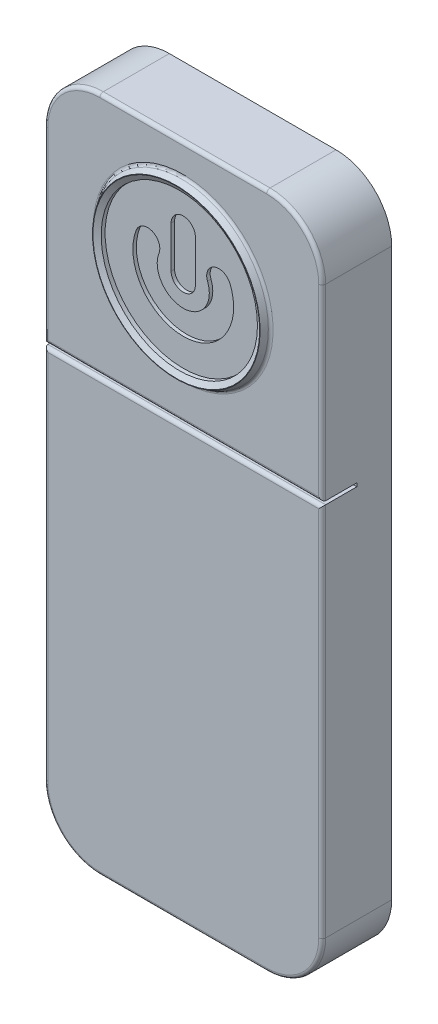
from build123d import *
from OCP.BRepFilletAPI import BRepFilletAPI_MakeChamfer

# Parameters (mm, degrees)
SKETCH1_W           = 8
SKETCH1_H           = 19.5
BOSS_EXTRUDE1_DEPTH = 2
FILLET1_R           = 1.6
CUT_EXTRUDE1_DEPTH  = 0.1
SKETCH4_R           = 2.5
SKETCH4_R_2         = 2.25
BOSS_EXTRUDE2_DEPTH = 0.2
CHAMFER1_SIZE       = 0.15
CHAMFER1_SIZE2      = 0.08660254
SKETCH5_W           = 8
SKETCH5_H           = 0.1
CUT_EXTRUDE2_DEPTH  = 1
FILLET2_R           = 0.1


with BuildPart() as part:
    # Sketch1 → Boss-Extrude1 (new body)
    with BuildSketch(Plane.XY):
        with Locations((4, 9.75)):
            Rectangle(SKETCH1_W, SKETCH1_H)
    extrude(amount=BOSS_EXTRUDE1_DEPTH)

    # Fillet1
    fillet1_edges = [part.edges().sort_by_distance(p)[0] for p in [
        (0, 19.5, 1),
        (8, 19.5, 1),
        (8, 0, 1),
        (0, 0, 1),
    ]]
    fillet(fillet1_edges, radius=FILLET1_R)

    # Sketch3 → Cut-Extrude1 (cut)
    with BuildSketch(Plane.XY.offset(2)):
        with BuildLine():
            Line((4.35, 17.3), (4.35, 16.1))
            ThreePointArc((4.35, 16.1), (4, 15.75), (3.65, 16.1))
            Line((3.65, 16.1), (3.65, 17.3))
            ThreePointArc((3.65, 17.3), (4, 17.65), (4.35, 17.3))
        make_face()
        with BuildLine():
            ThreePointArc((2.649265581, 16.627272727), (4, 14.65), (5.350734419, 16.627272727))
            ThreePointArc((5.350734419, 16.627272727), (4.897422349, 16.826039343), (4.698655734, 16.372727273))
            ThreePointArc((4.698655734, 16.372727273), (4, 15.35), (3.301344266, 16.372727273))
            ThreePointArc((3.301344266, 16.372727273), (3.102577651, 16.826039343), (2.649265581, 16.627272727))
        make_face()
    extrude(amount=-CUT_EXTRUDE1_DEPTH, mode=Mode.SUBTRACT)

    # Sketch4 → Boss-Extrude2 (add)
    with BuildSketch(Plane.XY.offset(2)):
        with Locations(Location((4, 16.1, 0), (0, 0, 180))):
            Circle(SKETCH4_R)
        with Locations((4, 16.1)):
            Circle(SKETCH4_R_2, mode=Mode.SUBTRACT)
    extrude(amount=BOSS_EXTRUDE2_DEPTH)

    # Chamfer1: one chamfer whose edges measure the first distance from different faces: ONE call of the kernel's chamfer builder (chamfer() names one face for all edges)
    chamfer1_edges_1 = [part.edges().sort_by_distance(p)[0] for p in [
        (6.5, 16.1, 2.2),
    ]]
    chamfer1_side_1 = [part.faces().sort_by_distance(p)[0] for p in [
        (6.5, 16.1, 2.1),
    ]]
    chamfer1_edges_2 = [part.edges().sort_by_distance(p)[0] for p in [
        (1.75, 16.1, 2.2),
    ]]
    chamfer1_side_2 = [part.faces().sort_by_distance(p)[0] for p in [
        (6.429289322, 16.1, 2.2),
    ]]
    chamfer1 = BRepFilletAPI_MakeChamfer(part.part.solid().wrapped)
    for e in chamfer1_edges_1:
        chamfer1.Add(CHAMFER1_SIZE, CHAMFER1_SIZE2, e.wrapped, chamfer1_side_1[0].wrapped)  # the first distance lies on this face
    for e in chamfer1_edges_2:
        chamfer1.Add(CHAMFER1_SIZE, CHAMFER1_SIZE2, e.wrapped, chamfer1_side_2[0].wrapped)  # the first distance lies on this face
    add(Compound.cast(chamfer1.Shape()), mode=Mode.REPLACE)

    # Sketch5 → Cut-Extrude2 (cut)
    with BuildSketch(Plane.XY.offset(2)):
        with Locations((4, 12.45)):
            Rectangle(SKETCH5_W, SKETCH5_H)
    extrude(amount=-CUT_EXTRUDE2_DEPTH, mode=Mode.SUBTRACT)

    # Fillet2
    # the kernel refuses this fillet: 0.1 mm, written as the material it adds along each edge
    with BuildSketch(Plane(origin=(4, 16.1, 2), x_dir=(-1, 0, 0), z_dir=(0, 1, 0))) as fillet2_piece_1:
        with BuildLine():
            CenterArc((2.58660254, 0.1), FILLET2_R, 210, 60)
            Line((2.58660254, 0), (2.5, 0))
            Line((2.5, 0), (2.5, 0.05))
        make_face()
    revolve(axis=Axis((4, 16.1, 2), (0, 0, 1)))
    # the kernel refuses this fillet: 0.1 mm, written as the material it takes off along each edge
    with BuildSketch(Plane(origin=(8, 1.6, 2), x_dir=(0, 0, -1), z_dir=(0, 1, 0)), Plane(origin=(0, 12.65, 2), x_dir=(0, 0, -1), z_dir=(0, -1, 0))) as fillet2_2_piece_1:
        with BuildLine():
            CenterArc((FILLET2_R, FILLET2_R), FILLET2_R, 180, 90)
            Line((0, FILLET2_R), (0, 0))
            Line((0, 0), (FILLET2_R, 0))
        make_face()
    extrude(amount=11.05, mode=Mode.SUBTRACT)
    with BuildSketch(Plane(origin=(1.6, 0, 2), x_dir=(0, 1, 0), z_dir=(1, 0, 0)), Plane(origin=(6.4, 19.5, 2), x_dir=(0, -1, 0), z_dir=(-1, 0, 0))) as fillet2_2_piece_2:
        with BuildLine():
            CenterArc((FILLET2_R, -FILLET2_R), FILLET2_R, 90, 90)
            Line((0, -FILLET2_R), (0, 0))
            Line((0, 0), (FILLET2_R, 0))
        make_face()
    extrude(amount=4.8, mode=Mode.SUBTRACT)
    with BuildSketch(Plane(origin=(0, 17.9, 2), x_dir=(1, 0, 0), z_dir=(0, -1, 0)), Plane(origin=(8, 12.25, 2), x_dir=(-1, 0, 0), z_dir=(0, 1, 0))) as fillet2_2_piece_3:
        with BuildLine():
            CenterArc((FILLET2_R, -FILLET2_R), FILLET2_R, 90, 90)
            Line((0, -FILLET2_R), (0, 0))
            Line((0, 0), (FILLET2_R, 0))
        make_face()
    extrude(amount=5.65, mode=Mode.SUBTRACT)
    with BuildSketch(Plane(origin=(1.6, 17.9, 2), x_dir=(0, 1, 0), z_dir=(1, 0, 0))) as fillet2_2_piece_4:
        with BuildLine():
            CenterArc((1.6 - FILLET2_R, -FILLET2_R), FILLET2_R, 0, 90)
            Line((1.6, -FILLET2_R), (1.6, 0))
            Line((1.6, 0), (1.6 - FILLET2_R, 0))
        make_face()
    revolve(axis=Axis((1.6, 17.9, 2), (0, 0, 1)), revolution_arc=90, mode=Mode.SUBTRACT)
    with BuildSketch(Plane(origin=(6.4, 17.9, 2), x_dir=(1, 0, 0), z_dir=(0, -1, 0))) as fillet2_2_piece_5:
        with BuildLine():
            CenterArc((1.6 - FILLET2_R, -FILLET2_R), FILLET2_R, 0, 90)
            Line((1.6, -FILLET2_R), (1.6, 0))
            Line((1.6, 0), (1.6 - FILLET2_R, 0))
        make_face()
    revolve(axis=Axis((6.4, 17.9, 2), (0, 0, 1)), revolution_arc=90, mode=Mode.SUBTRACT)
    with BuildSketch(Plane(origin=(1.6, 1.6, 2), x_dir=(0, -1, 0), z_dir=(1, 0, 0))) as fillet2_2_piece_6:
        with BuildLine():
            CenterArc((1.6 - FILLET2_R, FILLET2_R), FILLET2_R, 270, 90)
            Line((1.6 - FILLET2_R, 0), (1.6, 0))
            Line((1.6, 0), (1.6, FILLET2_R))
        make_face()
    revolve(axis=Axis((1.6, 1.6, 2), (0, 0, -1)), revolution_arc=90, mode=Mode.SUBTRACT)
    with BuildSketch(Plane(origin=(6.4, 1.6, 2), x_dir=(0, -1, 0), z_dir=(-1, 0, 0))) as fillet2_2_piece_7:
        with BuildLine():
            CenterArc((1.6 - FILLET2_R, -FILLET2_R), FILLET2_R, 0, 90)
            Line((1.6, -FILLET2_R), (1.6, 0))
            Line((1.6, 0), (1.6 - FILLET2_R, 0))
        make_face()
    revolve(axis=Axis((6.4, 1.6, 2), (0, 0, 1)), revolution_arc=90, mode=Mode.SUBTRACT)
    with BuildSketch(Plane(origin=(8.25, 12.4, 2), x_dir=(0, -1, 0), z_dir=(-1, 0, 0)), Plane(origin=(-0.25, 12.5, 2), x_dir=(0, 1, 0), z_dir=(1, 0, 0))) as fillet2_2_piece_8:
        with BuildLine():
            CenterArc((FILLET2_R, -FILLET2_R), FILLET2_R, 90, 90)
            Line((0, -FILLET2_R), (0, 0))
            Line((0, 0), (FILLET2_R, 0))
        make_face()
    extrude(amount=8.5, mode=Mode.SUBTRACT)


solid = part.part
